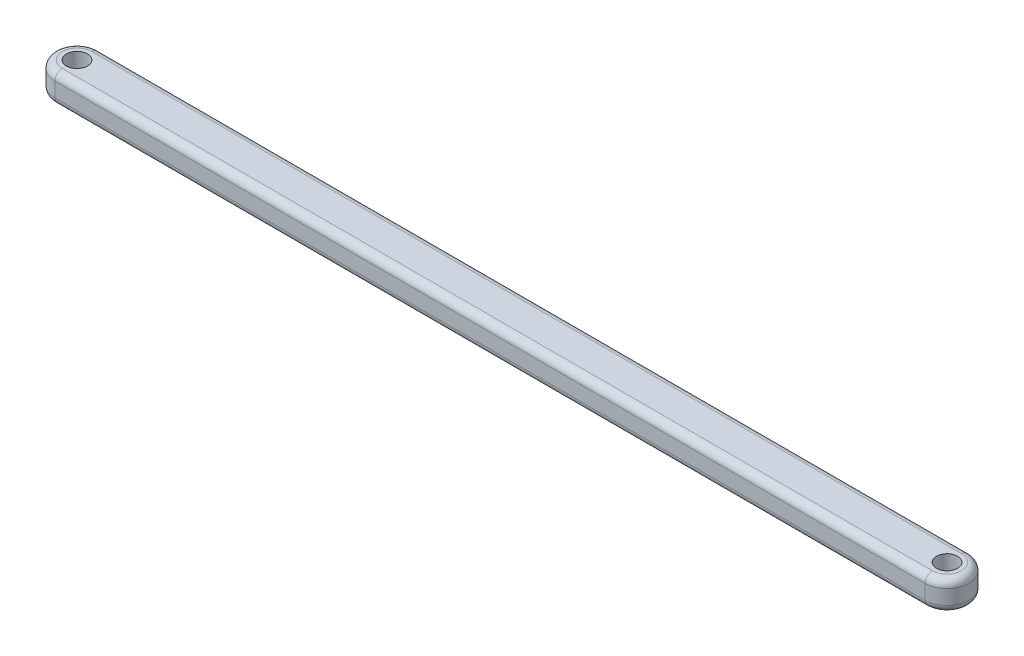
from build123d import *

# Parameters (mm, degrees)
BOSS_EXTRUDE1_DEPTH = 3.175
SKETCH2_R           = 2.286
CUT_EXTRUDE1_DEPTH  = 194.837585445
FILLET1_R           = 1.5875


with BuildPart() as part:
    # Sketch1 → Boss-Extrude1 (new, symmetric)
    with BuildSketch(Plane(origin=(0, 0, 0), x_dir=(1, 0, 0), z_dir=(0, 1, 0))):
        with BuildLine():
            Line((0, 4.7625), (188.9125, 4.7625))
            ThreePointArc((188.9125, 4.7625), (193.675, 0), (188.9125, -4.7625))
            Line((188.9125, -4.7625), (0, -4.7625))
            ThreePointArc((0, -4.7625), (-4.7625, 0), (0, 4.7625))
        make_face()
    extrude(amount=BOSS_EXTRUDE1_DEPTH, both=True)

    # Sketch2 → Cut-Extrude1 (cut, through all)
    with BuildSketch(Plane(origin=(0, 3.175, 0), x_dir=(1, 0, 0), z_dir=(0, 1, 0))):
        Circle(SKETCH2_R)
        with Locations((188.9125, 0)):
            Circle(SKETCH2_R)
    extrude(amount=-CUT_EXTRUDE1_DEPTH, mode=Mode.SUBTRACT)

    # Fillet1
    fillet1_edges = [part.edges().sort_by_distance(p)[0] for p in [
        (193.675, -3.175, 0),
        (94.45625, -3.175, 4.7625),
        (-4.7625, -3.175, 0),
        (193.675, 3.175, 0),
        (94.45625, 3.175, 4.7625),
        (-4.7625, 3.175, 0),
        (94.45625, -3.175, -4.7625),
        (94.45625, 3.175, -4.7625),
    ]]
    fillet(fillet1_edges, radius=FILLET1_R)


solid = part.part
